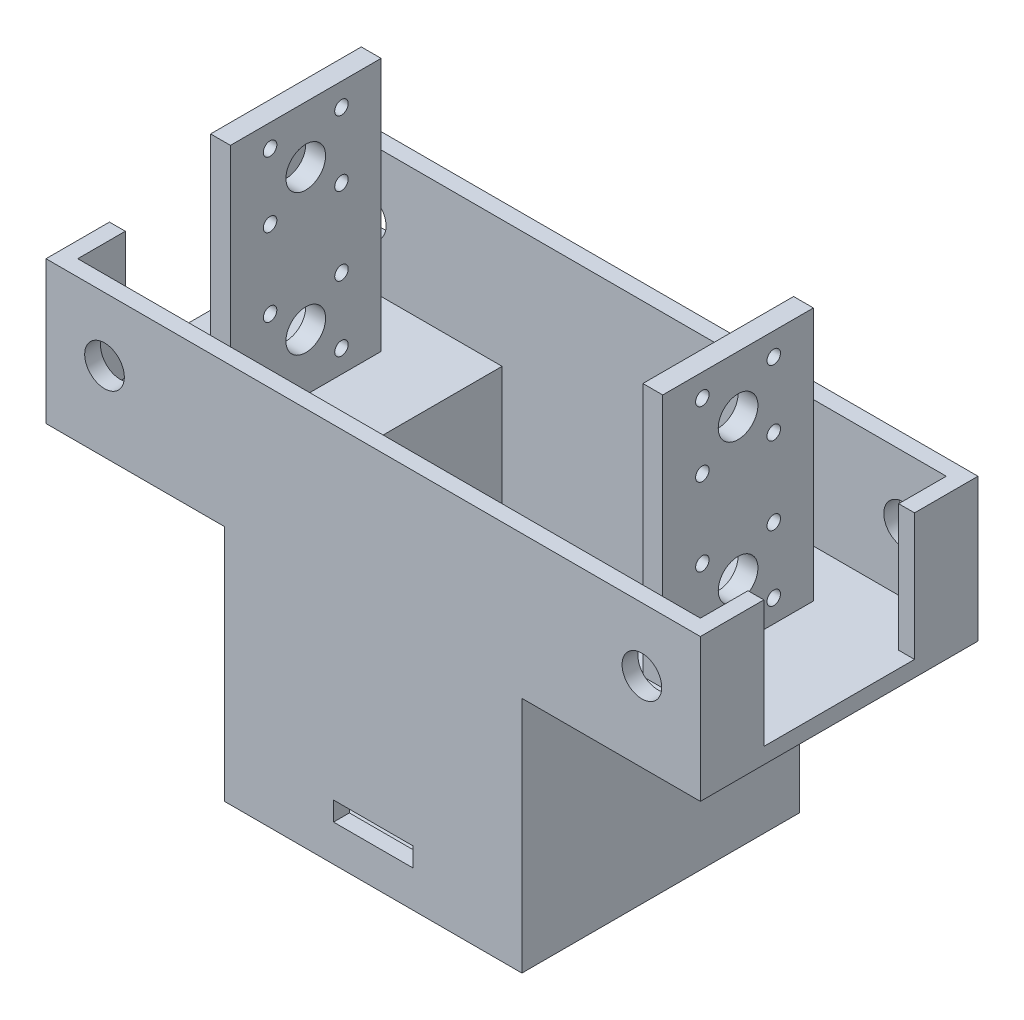
from build123d import *

# Parameters (mm, degrees)
SKETCH1_W                 = 75
SKETCH1_H                 = 40
SKETCH1_R                 = 5
SKETCH1_R_2               = 1.7
SKETCH1_R_3               = 1.197563381
SKETCH1_W_2               = 5
SKETCH1_H_2               = 20
BOSS_EXTRUDE1_DEPTH       = 3
CUT_EXTRUDE1_DEPTH        = 43.605750786
CUT_EXTRUDE1_DEPTH_BACK   = 43.605750786
SKETCH2_W                 = 67
SKETCH2_H                 = 28
BOSS_EXTRUDE3_DEPTH       = 90
BOSS_EXTRUDE3_DEPTH_BACK  = 3
SKETCH3_W                 = 75
SKETCH3_H                 = 70
SKETCH3_W_2               = 67
SKETCH3_H_2               = 40
SKETCH6_W                 = 67
SKETCH6_H                 = 11
CUT_EXTRUDE4_DEPTH        = 104.591746776
SKETCH7_W                 = 70
SKETCH7_H                 = 37
BOSS_EXTRUDE4_DEPTH       = 45
SKETCH8_W                 = 45
SKETCH8_H                 = 62
CUT_EXTRUDE6_DEPTH        = 29
SKETCH11_W                = 45
SKETCH11_H                = 4
CUT_EXTRUDE9_DEPTH        = 143.671826231
SKETCH9_W                 = 38
SKETCH9_H                 = 28.5
CUT_EXTRUDE10_DEPTH       = 193.611006954
SKETCH13_W                = 5
SKETCH13_H                = 38
BOSS_EXTRUDE5_DEPTH       = 32
SKETCH14_R                = 5
SKETCH14_R_2              = 1.7
CUT_EXTRUDE11_DEPTH       = 32
SKETCH15_W                = 165
SKETCH15_H                = 70
SKETCH15_W_2              = 157
SKETCH15_H_2              = 62
BOSS_EXTRUDE6_DEPTH       = 3
SKETCH16_W                = 20
SKETCH16_H                = 4.820648258
CUT_EXTRUDE12_DEPTH       = 145.645255712
SKETCH18_R                = 5
CUT_EXTRUDE14_DEPTH       = 145.645255712
MIRROR6_COPY_1_SKETCH_W   = 5
MIRROR6_COPY_1_SKETCH_H   = 38
MIRROR6_COPY_1_DEPTH      = 32
MIRROR6_COPY_2_SKETCH_R   = 5
MIRROR6_COPY_2_SKETCH_R_2 = 1.7
MIRROR6_COPY_2_DEPTH      = 32
MIRROR6_COPY_3_SKETCH_W   = 5
MIRROR6_COPY_3_SKETCH_H   = 38
MIRROR6_COPY_3_DEPTH      = 32
MIRROR6_COPY_4_SKETCH_R   = 5
MIRROR6_COPY_4_SKETCH_R_2 = 1.7
MIRROR6_COPY_4_DEPTH      = 32
SKETCH19_W                = 38
SKETCH19_H                = 3.5
CUT_EXTRUDE15_DEPTH       = 10


with BuildPart() as part:
    # Sketch1 → Boss-Extrude1 (new body)
    with BuildSketch(Plane(origin=(0, 0, 0), x_dir=(1, 0, 0), z_dir=(0, 1, 0))):
        Rectangle(SKETCH1_W, SKETCH1_H)
        with Locations((-21, 0)):
            Circle(SKETCH1_R, mode=Mode.SUBTRACT)
        with Locations((-30, 8.25)):
            Circle(SKETCH1_R_2, mode=Mode.SUBTRACT)
        with Locations((-12, 8.25)):
            Circle(SKETCH1_R_2, mode=Mode.SUBTRACT)
        with Locations((-12, -8.25)):
            Circle(SKETCH1_R_2, mode=Mode.SUBTRACT)
        with Locations((-30, -8.25)):
            Circle(SKETCH1_R_2, mode=Mode.SUBTRACT)
        with Locations((12, 8.25)):
            Circle(SKETCH1_R_2, mode=Mode.SUBTRACT)
        with Locations((12, -8.25)):
            Circle(SKETCH1_R_2, mode=Mode.SUBTRACT)
        with Locations((21, 0)):
            Circle(SKETCH1_R, mode=Mode.SUBTRACT)
        with Locations((30, -8.25)):
            Circle(SKETCH1_R_2, mode=Mode.SUBTRACT)
        with Locations((30, 8.25)):
            Circle(SKETCH1_R_2, mode=Mode.SUBTRACT)
        with Locations((-30, -17.5)):
            Circle(SKETCH1_R_3, mode=Mode.SUBTRACT)
        with Locations((-12, -17.5)):
            Circle(SKETCH1_R_3, mode=Mode.SUBTRACT)
        with Locations((12, -17.5)):
            Circle(SKETCH1_R_3, mode=Mode.SUBTRACT)
        with Locations((30, -17.5)):
            Circle(SKETCH1_R_3, mode=Mode.SUBTRACT)
        with Locations((30, 17.5)):
            Circle(SKETCH1_R_3, mode=Mode.SUBTRACT)
        with Locations((12, 17.5)):
            Circle(SKETCH1_R_3, mode=Mode.SUBTRACT)
        with Locations((-12, 17.5)):
            Circle(SKETCH1_R_3, mode=Mode.SUBTRACT)
        with Locations((-30, 17.5)):
            Circle(SKETCH1_R_3, mode=Mode.SUBTRACT)
        Rectangle(SKETCH1_W_2, SKETCH1_H_2, mode=Mode.SUBTRACT)
    extrude(amount=BOSS_EXTRUDE1_DEPTH)

    # Sketch2 → Cut-Extrude1 (cut, two sides: drawn at the far end of the back side and taken through both)
    with BuildSketch(Plane(origin=(0, 3, 0), x_dir=(1, 0, 0), z_dir=(0, 1, 0)).offset(-CUT_EXTRUDE1_DEPTH_BACK)):
        Rectangle(SKETCH2_W, SKETCH2_H)
    extrude(amount=CUT_EXTRUDE1_DEPTH + CUT_EXTRUDE1_DEPTH_BACK, mode=Mode.SUBTRACT)

    # Sketch3 → Boss-Extrude3 (add, two sides: drawn at the far end of the back side and taken through both)
    with BuildSketch(Plane(origin=(0, 3, 0), x_dir=(1, 0, 0), z_dir=(0, 1, 0)).offset(-BOSS_EXTRUDE3_DEPTH_BACK)):
        Rectangle(SKETCH3_W, SKETCH3_H)
        Rectangle(SKETCH3_W_2, SKETCH3_H_2, mode=Mode.SUBTRACT)
    extrude(amount=BOSS_EXTRUDE3_DEPTH + BOSS_EXTRUDE3_DEPTH_BACK)

    # Sketch6 → Cut-Extrude4 (cut, through all)
    with BuildSketch(Plane(origin=(0, 3, 0), x_dir=(1, 0, 0), z_dir=(0, 1, 0))):
        with Locations((0, -25.5)):
            Rectangle(SKETCH6_W, SKETCH6_H)
        with Locations((0, 25.5)):
            Rectangle(SKETCH6_W, SKETCH6_H)
    extrude(amount=CUT_EXTRUDE4_DEPTH, mode=Mode.SUBTRACT)

    # Sketch7 → Boss-Extrude4 (add)
    with BuildSketch(Plane.ZY.offset(37.5)):
        with Locations((0, 74.5)):
            Rectangle(SKETCH7_W, SKETCH7_H)
    boss_extrude4 = extrude(amount=BOSS_EXTRUDE4_DEPTH)

    # Mirror2: Boss-Extrude4 across plane
    add(boss_extrude4.mirror(Plane(origin=(0, 0, 0), x_dir=(0, 0, 1), z_dir=(1, 0, 0))))

    # Sketch8 → Cut-Extrude6 (cut)
    with BuildSketch(Plane(origin=(0, 93, 0), x_dir=(1, 0, 0), z_dir=(0, 1, 0))):
        with Locations((-56, 0)):
            Rectangle(SKETCH8_W, SKETCH8_H)
        with Locations((56, 0)):
            Rectangle(SKETCH8_W, SKETCH8_H)
    extrude(amount=-CUT_EXTRUDE6_DEPTH, mode=Mode.SUBTRACT)

    # Sketch11 → Cut-Extrude9 (cut, through all)
    with BuildSketch(Plane.XY.offset(35)):
        with Locations((-60, 58)):
            Rectangle(SKETCH11_W, SKETCH11_H)
        with Locations((60, 58)):
            Rectangle(SKETCH11_W, SKETCH11_H)
    extrude(amount=-CUT_EXTRUDE9_DEPTH, mode=Mode.SUBTRACT)

    # Sketch9 → Cut-Extrude10 (cut, through all)
    with BuildSketch(Plane.ZY.offset(82.5)):
        with Locations((0, 78.25)):
            Rectangle(SKETCH9_W, SKETCH9_H)
    extrude(amount=-CUT_EXTRUDE10_DEPTH, mode=Mode.SUBTRACT)

    # Sketch13 → Boss-Extrude5 (add)
    with BuildSketch(Plane(origin=(0, 64, 0), x_dir=(1, 0, 0), z_dir=(0, 1, 0))):
        with Locations((-54.5, 0)):
            Rectangle(SKETCH13_W, SKETCH13_H)
    boss_extrude5 = extrude(amount=BOSS_EXTRUDE5_DEPTH)

    # Sketch14 → Cut-Extrude11 (cut)
    with BuildSketch(Plane.ZY.offset(57)):
        with Locations((0, 78.25)):
            Circle(SKETCH14_R)
        with Locations((-9, 86.202083543)):
            Circle(SKETCH14_R_2)
        with Locations((9, 86.202083543)):
            Circle(SKETCH14_R_2)
        with Locations((9, 69.702083543)):
            Circle(SKETCH14_R_2)
        with Locations((-9, 69.702083543)):
            Circle(SKETCH14_R_2)
    cut_extrude11 = extrude(amount=-CUT_EXTRUDE11_DEPTH, mode=Mode.SUBTRACT)

    # Mirror4: Boss-Extrude5, Cut-Extrude11 across plane
    add(boss_extrude5.mirror(Plane(origin=(0, 0, 0), x_dir=(0, 0, 1), z_dir=(1, 0, 0))))
    add(cut_extrude11.mirror(Plane(origin=(0, 0, 0), x_dir=(0, 0, 1), z_dir=(1, 0, 0))), mode=Mode.SUBTRACT)

    # Sketch15 → Boss-Extrude6 (add)
    with BuildSketch(Plane(origin=(0, 93, 0), x_dir=(1, 0, 0), z_dir=(0, 1, 0))):
        Rectangle(SKETCH15_W, SKETCH15_H)
        Rectangle(SKETCH15_W_2, SKETCH15_H_2, mode=Mode.SUBTRACT)
    extrude(amount=BOSS_EXTRUDE6_DEPTH)

    # Sketch16 → Cut-Extrude12 (cut, through all)
    with BuildSketch(Plane.XY.offset(35)):
        with Locations((0, 11.636111214)):
            Rectangle(SKETCH16_W, SKETCH16_H)
    extrude(amount=-CUT_EXTRUDE12_DEPTH, mode=Mode.SUBTRACT)

    # Sketch18 → Cut-Extrude14 (cut, through all)
    with BuildSketch(Plane.XY.offset(35)):
        with Locations((67.75, 80)):
            Circle(SKETCH18_R)
    cut_extrude14 = extrude(amount=-CUT_EXTRUDE14_DEPTH, mode=Mode.SUBTRACT)

    # Mirror5: Cut-Extrude14 across plane
    add(cut_extrude14.mirror(Plane(origin=(0, 0, 0), x_dir=(0, 0, 1), z_dir=(1, 0, 0))), mode=Mode.SUBTRACT)

    # Mirror6 copy 1 sketch → Mirror6 copy 1 (add)
    with BuildSketch(Plane(origin=(0, 128, 0), x_dir=(-1, 0, 0), z_dir=(0, -1, 0))):
        with Locations((-54.5, 0)):
            Rectangle(MIRROR6_COPY_1_SKETCH_W, MIRROR6_COPY_1_SKETCH_H)
    extrude(amount=MIRROR6_COPY_1_DEPTH)

    # Mirror6 copy 2 sketch → Mirror6 copy 2 (cut)
    with BuildSketch(Plane(origin=(57, 192, 0), x_dir=(0, 0, 1), z_dir=(1, 0, 0))):
        with Locations((0, 78.25)):
            Circle(MIRROR6_COPY_2_SKETCH_R)
        with Locations((-9, 86.202083543)):
            Circle(MIRROR6_COPY_2_SKETCH_R_2)
        with Locations((9, 86.202083543)):
            Circle(MIRROR6_COPY_2_SKETCH_R_2)
        with Locations((9, 69.702083543)):
            Circle(MIRROR6_COPY_2_SKETCH_R_2)
        with Locations((-9, 69.702083543)):
            Circle(MIRROR6_COPY_2_SKETCH_R_2)
    extrude(amount=-MIRROR6_COPY_2_DEPTH, mode=Mode.SUBTRACT)

    # Mirror6 copy 3 sketch → Mirror6 copy 3 (add)
    with BuildSketch(Plane.XZ.offset(-128)):
        with Locations((-54.5, 0)):
            Rectangle(MIRROR6_COPY_3_SKETCH_W, MIRROR6_COPY_3_SKETCH_H)
    extrude(amount=MIRROR6_COPY_3_DEPTH)

    # Mirror6 copy 4 sketch → Mirror6 copy 4 (cut)
    with BuildSketch(Plane(origin=(-57, 192, 0), x_dir=(0, 0, 1), z_dir=(-1, 0, 0))):
        with Locations((0, -78.25)):
            Circle(MIRROR6_COPY_4_SKETCH_R)
        with Locations((-9, -86.202083543)):
            Circle(MIRROR6_COPY_4_SKETCH_R_2)
        with Locations((9, -86.202083543)):
            Circle(MIRROR6_COPY_4_SKETCH_R_2)
        with Locations((9, -69.702083543)):
            Circle(MIRROR6_COPY_4_SKETCH_R_2)
        with Locations((-9, -69.702083543)):
            Circle(MIRROR6_COPY_4_SKETCH_R_2)
    extrude(amount=-MIRROR6_COPY_4_DEPTH, mode=Mode.SUBTRACT)

    # Sketch19 → Cut-Extrude15 (cut)
    with BuildSketch(Plane(origin=(82.5, 0, 0), x_dir=(0, 0, -1), z_dir=(1, 0, 0))):
        with Locations((0, 94.25)):
            Rectangle(SKETCH19_W, SKETCH19_H)
    cut_extrude15 = extrude(amount=-CUT_EXTRUDE15_DEPTH, mode=Mode.SUBTRACT)

    # Mirror7: Cut-Extrude15 across plane
    add(cut_extrude15.mirror(Plane(origin=(0, 0, 0), x_dir=(0, 0, 1), z_dir=(1, 0, 0))), mode=Mode.SUBTRACT)


solid = part.part
